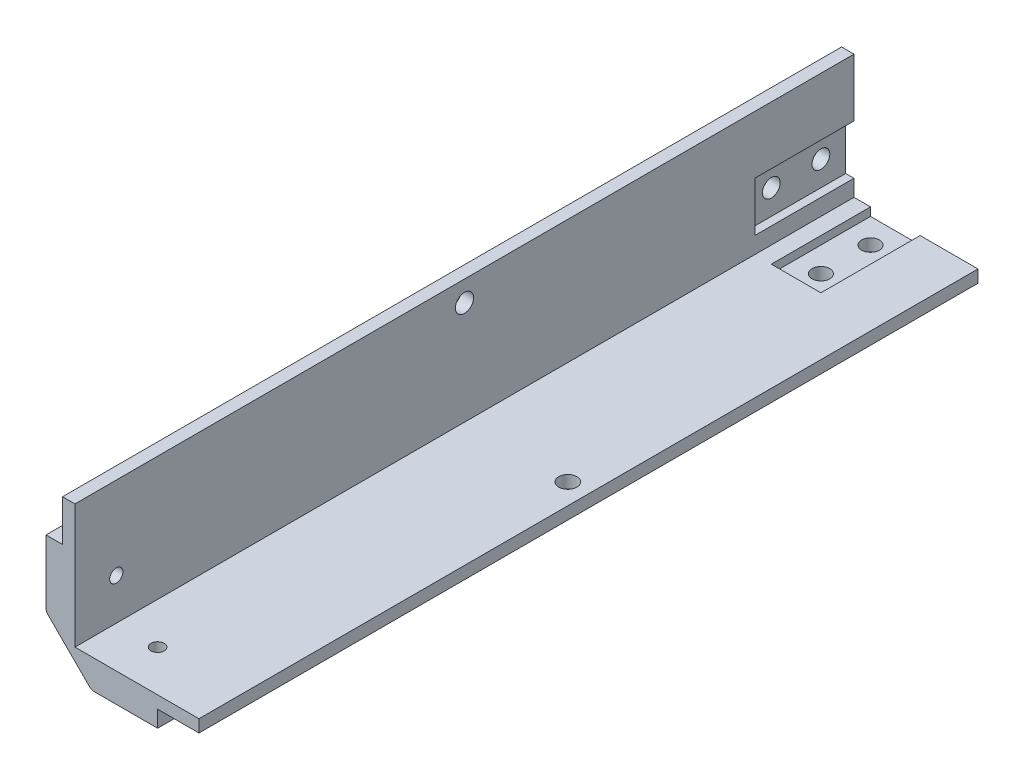
from build123d import *

# Parameters (mm, degrees)
BOSS_EXTRUDE1_DEPTH                = 188.45
SKETCH6_W                          = 188.45
SKETCH6_H                          = 3
BOSS_EXTRUDE2_DEPTH                = 10
SKETCH7_W                          = 13
SKETCH7_H                          = 188.45
BOSS_EXTRUDE3_DEPTH                = 4
SKETCH8_W                          = 3
SKETCH8_H                          = 188.45
BOSS_EXTRUDE4_DEPTH                = 10
SKETCH9_W                          = 188.45
SKETCH9_H                          = 13
BOSS_EXTRUDE5_DEPTH                = 4
CSK_FOR_M3_SFHCS1_D                = 3.2
CSK_FOR_M3_SFHCS1_CSINK_D          = 6.72
CSK_FOR_M3_SFHCS1_CSINK_ANGLE      = 90
CSK_FOR_M3_SFHCS2_D                = 3.2
CSK_FOR_M3_SFHCS2_CSINK_D          = 6.72
CSK_FOR_M3_SFHCS2_CSINK_ANGLE      = 90
FILLET1_R                          = 1.5
F_4_4_4_4_DIAMETER_HOLE1_D         = 4.4
F_4_4_4_4_DIAMETER_HOLE1_DEPTH     = 10
F_4_4_4_4_DIAMETER_HOLE1_TIP       = 1.321893362
F_4_4_4_4_DIAMETER_HOLE3_D         = 4.4
F_4_4_4_4_DIAMETER_HOLE3_DEPTH     = 10
F_4_4_4_4_DIAMETER_HOLE3_TIP       = 1.321893362
SKETCH18_W                         = 12
SKETCH18_H                         = 24
CUT_EXTRUDE1_DEPTH                 = 2
F_4_3_START                        = -5
F_4_3_4_3_DIAMETER_HOLE1_OUTLINE_R = 2.15
F_4_3_4_3_DIAMETER_HOLE1_DEPTH     = 3
SKETCH21_W                         = 24
SKETCH21_H                         = 12
CUT_EXTRUDE2_DEPTH                 = 2
F_4_3_4_3_DIAMETER_HOLE2_OUTLINE_R = 2.15
F_4_3_4_3_DIAMETER_HOLE2_DEPTH     = 3


# Read off the part's stored shape, not the designer's step: Ø4.3 (4.3) Diameter Hole1, Ø4.3 (4.3) Diameter Hole2
with BuildPart() as part:
    # Sketch1 → Boss-Extrude1 (new body)
    with BuildSketch(Plane.XY.offset(280)):
        Polygon((-7, 4), (4, -7), (7, -7), (7, -3), (20, -3), (20, 0), (0, 0), (0, 20), (-3, 20), (-3, 7), (-7, 7), align=None)
    extrude(amount=-BOSS_EXTRUDE1_DEPTH)

    # Sketch6 → Boss-Extrude2 (add)
    with BuildSketch(Plane(origin=(20, 0, 0), x_dir=(0, 0, -1), z_dir=(1, 0, 0))):
        with Locations((-185.775, -1.5)):
            Rectangle(SKETCH6_W, SKETCH6_H)
    extrude(amount=BOSS_EXTRUDE2_DEPTH)

    # Sketch7 → Boss-Extrude3 (add)
    with BuildSketch(Plane.XZ.offset(3)):
        with Locations((13.5, 185.775)):
            Rectangle(SKETCH7_W, SKETCH7_H)
    extrude(amount=BOSS_EXTRUDE3_DEPTH)

    # Sketch8 → Boss-Extrude4 (add)
    with BuildSketch(Plane(origin=(0, 20, 0), x_dir=(1, 0, 0), z_dir=(0, 1, 0))):
        with Locations((-1.5, -185.775)):
            Rectangle(SKETCH8_W, SKETCH8_H)
    extrude(amount=BOSS_EXTRUDE4_DEPTH)

    # Sketch9 → Boss-Extrude5 (add)
    with BuildSketch(Plane.ZY.offset(3)):
        with Locations((185.775, 13.5)):
            Rectangle(SKETCH9_W, SKETCH9_H)
    extrude(amount=BOSS_EXTRUDE5_DEPTH)

    # CSK for M3 SFHCS1 (through all)
    with Locations(Plane.XZ.offset(7)):
        with Locations((10, 270)):
            CounterSinkHole(CSK_FOR_M3_SFHCS1_D / 2, CSK_FOR_M3_SFHCS1_CSINK_D / 2, counter_sink_angle=CSK_FOR_M3_SFHCS1_CSINK_ANGLE)

    # CSK for M3 SFHCS2 (through all)
    with Locations(Plane.ZY.offset(7)):
        with Locations((270, 10)):
            CounterSinkHole(CSK_FOR_M3_SFHCS2_D / 2, CSK_FOR_M3_SFHCS2_CSINK_D / 2, counter_sink_angle=CSK_FOR_M3_SFHCS2_CSINK_ANGLE)

    # Fillet1
    fillet1_edges = [part.edges().sort_by_distance(p)[0] for p in [
        (4, -7, 185.775),
        (-7, 4, 185.775),
    ]]
    fillet(fillet1_edges, radius=FILLET1_R)

    # Ø4.4 (4.4) Diameter Hole1
    with Locations(Plane.ZY.offset(3)):
        with Locations((185.775, 25)):
            Hole(F_4_4_4_4_DIAMETER_HOLE1_D / 2, depth=F_4_4_4_4_DIAMETER_HOLE1_DEPTH)
            with Locations((0, 0, -(F_4_4_4_4_DIAMETER_HOLE1_DEPTH + F_4_4_4_4_DIAMETER_HOLE1_TIP / 2))):  # 118° drill point
                Cone(0, F_4_4_4_4_DIAMETER_HOLE1_D / 2, F_4_4_4_4_DIAMETER_HOLE1_TIP, mode=Mode.SUBTRACT)

    # Ø4.4 (4.4) Diameter Hole3
    with Locations(Plane.XZ.offset(3)):
        with Locations((25, 185.775)):
            Hole(F_4_4_4_4_DIAMETER_HOLE3_D / 2, depth=F_4_4_4_4_DIAMETER_HOLE3_DEPTH)
            with Locations((0, 0, -(F_4_4_4_4_DIAMETER_HOLE3_DEPTH + F_4_4_4_4_DIAMETER_HOLE3_TIP / 2))):  # 118° drill point
                Cone(0, F_4_4_4_4_DIAMETER_HOLE3_D / 2, F_4_4_4_4_DIAMETER_HOLE3_TIP, mode=Mode.SUBTRACT)

    # Sketch18 → Cut-Extrude1 (cut)
    with BuildSketch(Plane(origin=(0, 0, 0), x_dir=(1, 0, 0), z_dir=(0, 1, 0))):
        with Locations((10, -103.55)):
            Rectangle(SKETCH18_W, SKETCH18_H)
    extrude(amount=-CUT_EXTRUDE1_DEPTH, mode=Mode.SUBTRACT)

    # Ø4.3 (4.3) Diameter Hole1 outline → Ø4.3 (4.3) Diameter Hole1 (cut)
    with BuildSketch(Plane(origin=(0, 0, 0), x_dir=(1, 0, 0), z_dir=(0, 1, 0)).offset(F_4_3_START)):
        with Locations((10, -109.55)):
            Circle(F_4_3_4_3_DIAMETER_HOLE1_OUTLINE_R)
        with Locations((10, -97.55)):
            Circle(F_4_3_4_3_DIAMETER_HOLE1_OUTLINE_R)
    extrude(amount=F_4_3_4_3_DIAMETER_HOLE1_DEPTH, mode=Mode.SUBTRACT)

    # Sketch21 → Cut-Extrude2 (cut)
    with BuildSketch(Plane(origin=(0, 0, 0), x_dir=(0, 0, -1), z_dir=(1, 0, 0))):
        with Locations((-103.55, 10)):
            Rectangle(SKETCH21_W, SKETCH21_H)
    extrude(amount=-CUT_EXTRUDE2_DEPTH, mode=Mode.SUBTRACT)

    # Ø4.3 (4.3) Diameter Hole2 outline → Ø4.3 (4.3) Diameter Hole2 (cut)
    with BuildSketch(Plane.YZ.offset(F_4_3_START)):
        with Locations((10, 109.55)):
            Circle(F_4_3_4_3_DIAMETER_HOLE2_OUTLINE_R)
        with Locations((10, 97.55)):
            Circle(F_4_3_4_3_DIAMETER_HOLE2_OUTLINE_R)
    extrude(amount=F_4_3_4_3_DIAMETER_HOLE2_DEPTH, mode=Mode.SUBTRACT)


solid = part.part
